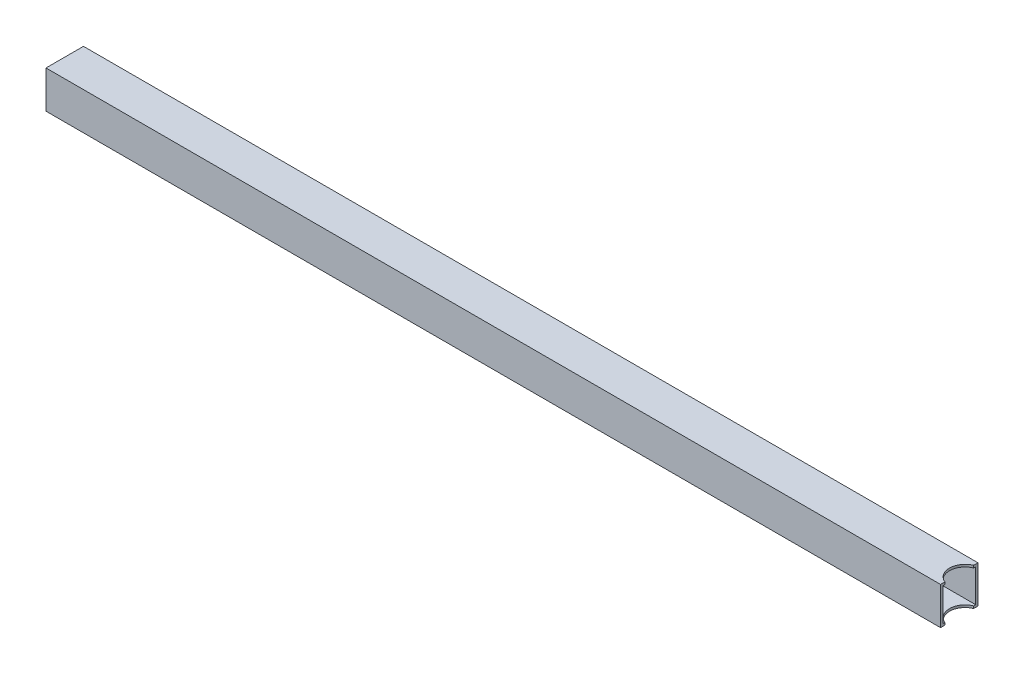
from build123d import *

# Parameters (mm, degrees)
BOSS_EXTRUDE1_DEPTH      = 590.55
BOSS_EXTRUDE1_DEPTH_BACK = 590.55
SKETCH1_W                = 50.8
SKETCH1_H                = 50.8
SKETCH1_W_2              = 44.45
SKETCH1_H_2              = 44.45
SKETCH6_W                = 50.8
SKETCH6_H                = 50.8
SKETCH6_W_2              = 44.45
SKETCH6_H_2              = 44.45
BOSS_EXTRUDE2_DEPTH      = 31.75
SKETCH7_R                = 21.082
CUT_EXTRUDE1_DEPTH       = 50.8


with BuildPart() as part:
    # Sketch1 → Boss-Extrude1 (new, two sides: drawn at the far end of the back side and taken through both)
    with BuildSketch(Plane(origin=(0, 0, 0), x_dir=(0, 0, -1), z_dir=(1, 0, 0)).offset(-BOSS_EXTRUDE1_DEPTH_BACK)):
        Rectangle(SKETCH1_W, SKETCH1_H)
        Rectangle(SKETCH1_W_2, SKETCH1_H_2, mode=Mode.SUBTRACT)
    extrude(amount=BOSS_EXTRUDE1_DEPTH + BOSS_EXTRUDE1_DEPTH_BACK)

    # Sketch6 → Boss-Extrude2 (add)
    with BuildSketch(Plane(origin=(590.55, 0, 0), x_dir=(0, 0, -1), z_dir=(1, 0, 0))):
        Rectangle(SKETCH6_W, SKETCH6_H)
        Rectangle(SKETCH6_W_2, SKETCH6_H_2, mode=Mode.SUBTRACT)
    extrude(amount=BOSS_EXTRUDE2_DEPTH)

    # Sketch7 → Cut-Extrude1 (cut)
    with BuildSketch(Plane(origin=(0, 25.4, 0), x_dir=(1, 0, 0), z_dir=(0, 1, 0))):
        with Locations((630.2375, 0)):
            Circle(SKETCH7_R)
    extrude(amount=-CUT_EXTRUDE1_DEPTH, mode=Mode.SUBTRACT)


solid = part.part
